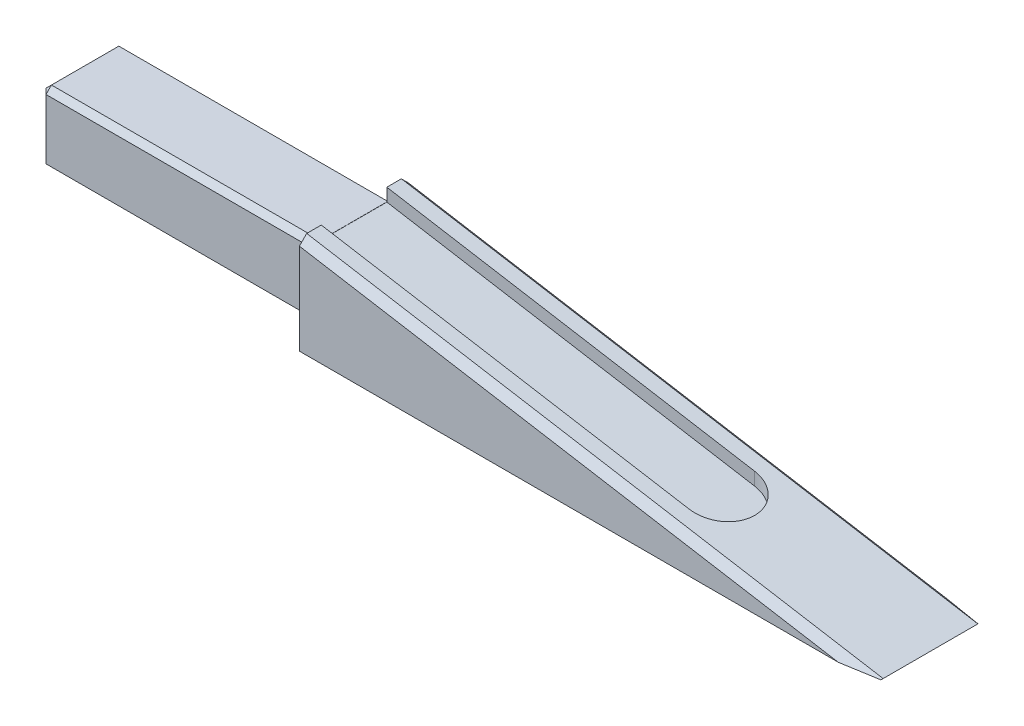
from build123d import *
from OCP.BRepFilletAPI import BRepFilletAPI_MakeChamfer

# Parameters (mm, degrees)
BOSS_EXTRUDE1_DEPTH = 7.5
SKETCH3_W           = 10.75
SKETCH3_H           = 9.75
BOSS_EXTRUDE2_DEPTH = 37.67
CUT_EXTRUDE9_START  = -3
CUT_EXTRUDE9_DEPTH  = 9
FILLET1_R           = 4.5
CHAMFER1_SIZE       = 1
CHAMFER1_SIZE2      = 0.867711944
CHAMFER3_SIZE       = 0.75


with BuildPart() as part:
    # Sketch2 → Boss-Extrude1 (new, symmetric)
    with BuildSketch(Plane.XY):
        Polygon((0, 0), (80, 0), (0, 13.5), align=None)
    extrude(amount=BOSS_EXTRUDE1_DEPTH, both=True)

    # Sketch3 → Boss-Extrude2 (add)
    with BuildSketch(Plane.ZY):
        with Locations((0, 6.875)):
            Rectangle(SKETCH3_W, SKETCH3_H)
    extrude(amount=BOSS_EXTRUDE2_DEPTH)

    # Sketch4 → Cut-Extrude9 (cut)
    with BuildSketch(Plane.XY.offset(7.5).offset(CUT_EXTRUDE9_START)):
        Polygon((55, 4.21875), (0, 13.5), (0, 11.725257914), (55, 2.444007914), align=None)
    extrude(amount=-CUT_EXTRUDE9_DEPTH, mode=Mode.SUBTRACT)

    # Fillet1
    fillet1_edges = [part.edges().sort_by_distance(p)[0] for p in [
        (55, 3.331378957, 4.5),
        (55, 3.331378957, -4.5),
    ]]
    fillet(fillet1_edges, radius=FILLET1_R - 0.0001)  # a hair under: the kernel refuses the full size

    # Chamfer1: one chamfer whose edges measure the first distance from different faces: ONE call of the kernel's chamfer builder (chamfer() names one face for all edges)
    chamfer1_edges_1 = [part.edges().sort_by_distance(p)[0] for p in [
        (40, 6.75, 7.5),
        (40, 6.75, -7.5),
    ]]
    chamfer1_edges_2 = [part.edges().sort_by_distance(p)[0] for p in [
        (80, 0, 0),
    ]]
    chamfer1_side_2 = [part.faces().sort_by_distance(p)[0] for p in [
        (40, 0, 0),
    ]]
    chamfer1 = BRepFilletAPI_MakeChamfer(part.part.solid().wrapped)
    for e in chamfer1_edges_1:
        chamfer1.Add(CHAMFER1_SIZE, e.wrapped)
    for e in chamfer1_edges_2:
        chamfer1.Add(CHAMFER1_SIZE, CHAMFER1_SIZE2, e.wrapped, chamfer1_side_2[0].wrapped)  # the first distance lies on this face
    add(Compound.cast(chamfer1.Shape()), mode=Mode.REPLACE)

    # Chamfer3
    chamfer3_edges = [part.edges().sort_by_distance(p)[0] for p in [
        (-18.835, 11.75, -5.375),
        (-18.835, 2, -5.375),
        (-18.835, 2, 5.375),
        (-18.835, 11.75, 5.375),
        (-37.67, 6.875, -5.375),
        (-37.67, 2, 0),
        (-37.67, 6.875, 5.375),
        (-37.67, 11.75, 0),
    ]]
    chamfer(chamfer3_edges, length=CHAMFER3_SIZE)


solid = part.part
